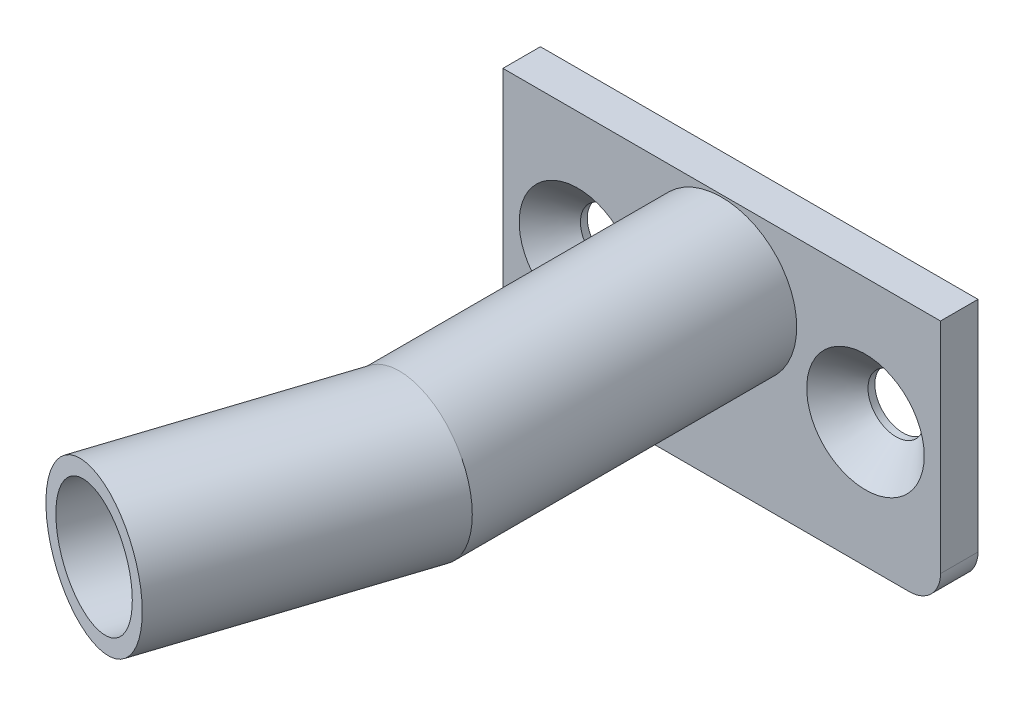
from build123d import *

# Parameters (mm, degrees)
SKETCH7_W                                      = 35
SKETCH7_H                                      = 20
BOSS_EXTRUDE4_DEPTH                            = 3
FILLET1_R                                      = 2.5
SKETCH8_R                                      = 6
BOSS_EXTRUDE5_DEPTH                            = 20
SKETCH10_R                                     = 6
BOSS_EXTRUDE6_START                            = 15
SKETCH11_R                                     = 6
SKETCH11_R_2                                   = 4.7625
BOSS_EXTRUDE6_DEPTH                            = 15
CSK_FOR_M4_FLAT_HEAD_MACHINE_SCREW1_AT_2_COUNT = 2
CSK_FOR_M4_FLAT_HEAD_MACHINE_SCREW1_AT_2_PITCH = 23


with BuildPart() as part:
    # Sketch7 → Boss-Extrude4 (new body)
    with BuildSketch(Plane.XY):
        Rectangle(SKETCH7_W, SKETCH7_H)
    extrude(amount=BOSS_EXTRUDE4_DEPTH)

    # Fillet1
    fillet1_edges = [part.edges().sort_by_distance(p)[0] for p in [
        (17.5, -10, 1.5),
        (-17.5, -10, 1.5),
    ]]
    fillet(fillet1_edges, radius=FILLET1_R)

    # Sketch8 → Boss-Extrude5 (add)
    with BuildSketch(Plane.XY.offset(3)):
        with Locations((0, 3.825)):
            Circle(SKETCH8_R)
    extrude(amount=BOSS_EXTRUDE5_DEPTH)

    # Sweep3: sweep along a path in Sketch9
    with BuildLine(Plane(origin=(0, 3.825, 0), x_dir=(1, 0, 0), z_dir=(0, 1, 0))) as sweep3_path:
        Line((0, -23), (0, -28))
        Line((0, -28), (-1.545084972, -32.755282581))
    # Sketch10 → Sweep3 (sweep)
    with BuildSketch(Plane.XY.offset(23)):
        with Locations((0, 3.825)):
            Circle(SKETCH10_R)
    sweep(path=sweep3_path.line, transition=Transition.RIGHT)

    # Sketch11 → Boss-Extrude6 (add)
    with BuildSketch(Plane(origin=(-9.774078504, 0, 30.081520503), x_dir=(0.9510565162951534, 0, 0.3090169943749484), z_dir=(-0.3090169943749484, 0, 0.9510565162951534)).offset(BOSS_EXTRUDE6_START)):
        with Locations((8.652475842, 3.825)):
            Circle(SKETCH11_R)
        with Locations((8.652475842, 3.825)):
            Circle(SKETCH11_R_2, mode=Mode.SUBTRACT)
    extrude(amount=-BOSS_EXTRUDE6_DEPTH)

    # Sketch13 → CSK for M4 Flat Head Machine Screw1 (revolve, cut)
    with BuildSketch(Plane(origin=(-11.5, 0, 3), x_dir=(0, -1, 0), z_dir=(1, 0, 0))):
        Polygon((0, 0), (0, 3), (2.25, 3), (2.25, 2.45), (4.7, 0), align=None)
    csk_for_m4_flat_head_machine_screw1 = revolve(axis=Axis((-11.5, 0, 9.35), (0, 0, -1)), mode=Mode.SUBTRACT)

    # CSK for M4 Flat Head Machine Screw1 at 2: CSK for M4 Flat Head Machine Screw1 ×2
    with Locations(*[(i * CSK_FOR_M4_FLAT_HEAD_MACHINE_SCREW1_AT_2_PITCH, 0, 0) for i in range(1, CSK_FOR_M4_FLAT_HEAD_MACHINE_SCREW1_AT_2_COUNT)]):
        add(csk_for_m4_flat_head_machine_screw1, mode=Mode.SUBTRACT)


solid = part.part
